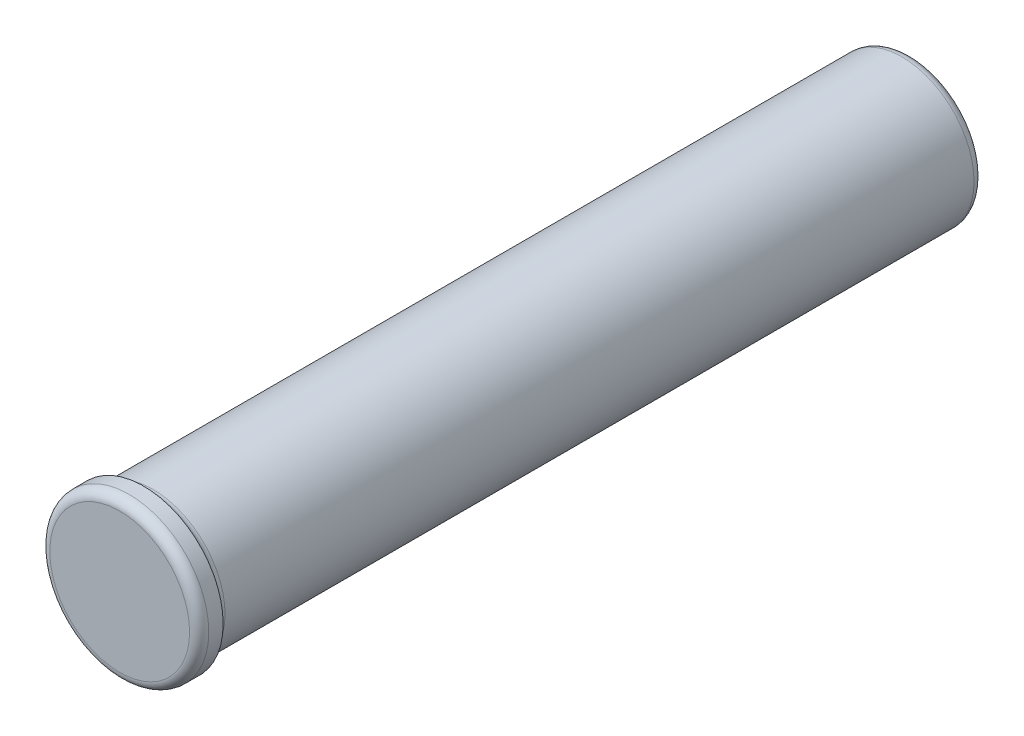
from build123d import *

# Parameters (mm, degrees)
SKETCH1_R           = 0.15
BOSS_EXTRUDE1_DEPTH = 1.65
SKETCH2_R           = 0.165582224
BOSS_EXTRUDE2_DEPTH = 0.05
FILLET1_R           = 0.02
FILLET2_R           = 0.02
FILLET3_R           = 0.02


with BuildPart() as part:
    # Sketch1 → Boss-Extrude1 (new body)
    with BuildSketch(Plane.XY):
        Circle(SKETCH1_R)
    extrude(amount=BOSS_EXTRUDE1_DEPTH)

    # Sketch2 → Boss-Extrude2 (add)
    with BuildSketch(Plane.XY.offset(1.65)):
        Circle(SKETCH2_R)
    extrude(amount=-BOSS_EXTRUDE2_DEPTH)

    # Fillet1
    fillet1_edges = [part.edges().sort_by_distance(p)[0] for p in [
        (-0.165582224, 0, 1.65),
    ]]
    fillet(fillet1_edges, radius=FILLET1_R)

    # Fillet2
    # the kernel refuses this fillet: 0.02 mm, written as the material it adds along each edge
    with BuildSketch(Plane(origin=(0, 0, 1.6), x_dir=(1, 0, 0), z_dir=(0, 1, 0))) as fillet2_piece_1_section:
        with BuildLine():
            CenterArc((0.15 + FILLET2_R, FILLET2_R), FILLET2_R, 180, 90)
            Line((0.15, FILLET2_R), (0.15, 0))
            Line((0.15, 0), (0.15 + FILLET2_R, 0))
        make_face()
    fillet2_piece_1 = revolve(axis=Axis((0, 0, 1.6), (0, 0, -1)), mode=Mode.PRIVATE)
    fillet2_piece_1 = fillet2_piece_1 & Plane(origin=(0, 0, 1.592769075), x_dir=(1, 0, 0), z_dir=(0, 0, 1)) * Cylinder(0.165582224, 1, mode=Mode.PRIVATE)
    add(fillet2_piece_1)

    # Fillet3
    fillet3_edges = [part.edges().sort_by_distance(p)[0] for p in [
        (-0.15, 0, 0),
    ]]
    fillet(fillet3_edges, radius=FILLET3_R)


solid = part.part
